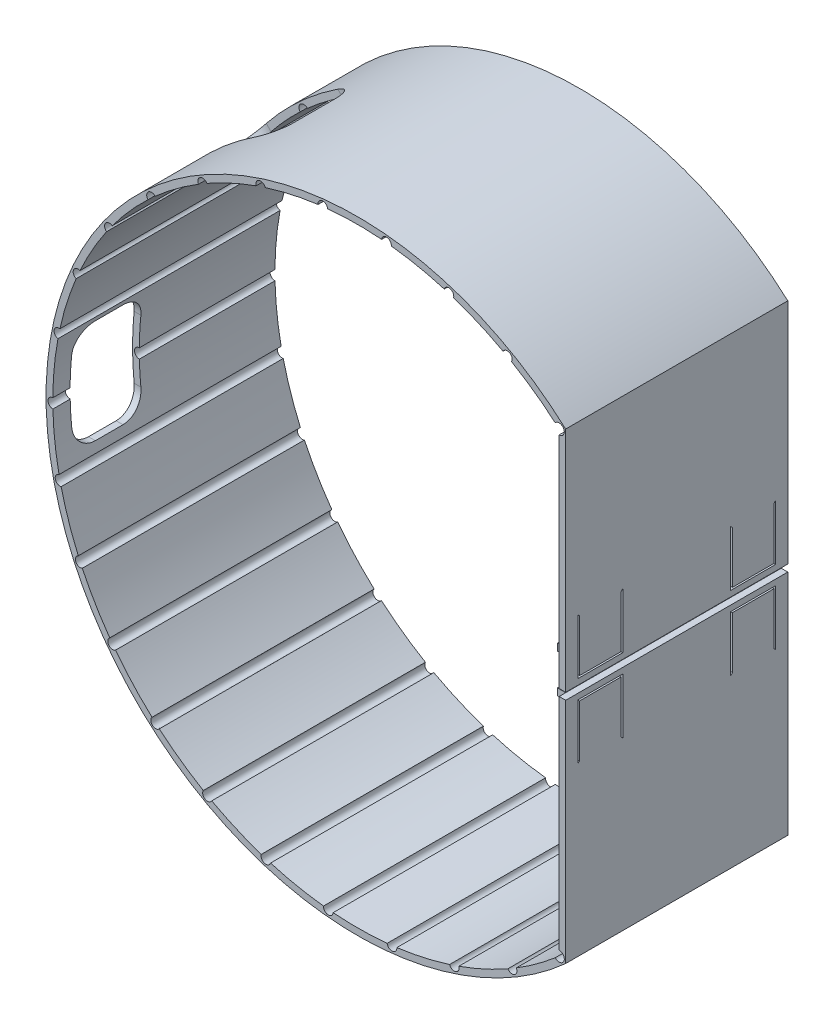
from build123d import *

# Parameters (mm, degrees)
BOSS_EXTRUDE1_DEPTH     = 64.2
SKETCH3_W               = 24
SKETCH3_H               = 40
CUT_EXTRUDE1_DEPTH      = 120.2
SKETCH4_W               = 30
SKETCH4_H               = 20
CUT_EXTRUDE2_DEPTH      = 120.2
FILLET1_R               = 6
SKETCH5_W               = 2
SKETCH5_H               = 9
BOSS_EXTRUDE2_DEPTH     = 6
BOSS_EXTRUDE3_DEPTH     = 9
CUT_EXTRUDE3_DEPTH      = 9
MIRROR2_COPY_1_SKETCH_W = 2
MIRROR2_COPY_1_SKETCH_H = 9
MIRROR2_COPY_1_DEPTH    = 6
MIRROR2_COPY_2_DEPTH    = 9
MIRROR2_COPY_3_DEPTH    = 9
SKETCH9_R               = 1.4
SKETCH9_R_2             = 1.5
CUT_EXTRUDE5_DEPTH      = 100


with BuildPart() as part:
    # Sketch1 → Boss-Extrude1 (new body)
    with BuildSketch(Plane(origin=(0, 0, 0), x_dir=(0, 1, 0), z_dir=(0, 0, 1))):
        with BuildLine():
            Line((-66.902615793, -60.2), (-1, -60.2))
            Line((-1, -60.2), (-1, -58.3))
            Line((-1, -58.3), (-65.984183711, -58.3))
            ThreePointArc((-65.984183711, -58.3), (0, 88.05), (65.984183711, -58.3))
            Line((65.984183711, -58.3), (1, -58.3))
            Line((1, -58.3), (1, -60.2))
            Line((1, -60.2), (66.902615793, -60.2))
            ThreePointArc((66.902615793, -60.2), (0, 90), (-66.902615793, -60.2))
        make_face()
    extrude(amount=BOSS_EXTRUDE1_DEPTH)

    # Sketch3 → Cut-Extrude1 (cut)
    with BuildSketch(Plane(origin=(0, 0, 0), x_dir=(0, 0, -1), z_dir=(0.7071067811865464, -0.7071067811865488, 0))):
        with Locations((-32.2, 3.95)):
            Rectangle(SKETCH3_W, SKETCH3_H)
    extrude(amount=-CUT_EXTRUDE1_DEPTH, mode=Mode.SUBTRACT)

    # Sketch4 → Cut-Extrude2 (cut)
    with BuildSketch(Plane.YZ):
        with Locations((0, 49.2)):
            Rectangle(SKETCH4_W, SKETCH4_H)
    extrude(amount=-CUT_EXTRUDE2_DEPTH, mode=Mode.SUBTRACT)

    # Fillet1
    fillet1_edges = [part.edges().sort_by_distance(p)[0] for p in [
        (-43.693886042, 77.564300861, 44.2),
        (-73.267623998, 50.569496322, 44.2),
        (-73.267623998, 50.569496322, 20.2),
        (-43.693886042, 77.564300861, 20.2),
        (-87.752053224, 15, 39.2),
        (-87.752053224, -15, 39.2),
        (-87.752053224, -15, 59.2),
        (-87.752053224, 15, 59.2),
    ]]
    fillet(fillet1_edges, radius=FILLET1_R)

    # Sketch5 → Boss-Extrude2 (add)
    with BuildSketch(Plane(origin=(58.3, 0, 0), x_dir=(0, -1, 0), z_dir=(-1, 0, 0))):
        with Locations((-5.584183711, 54.2)):
            Rectangle(SKETCH5_W, SKETCH5_H)
    boss_extrude2 = extrude(amount=BOSS_EXTRUDE2_DEPTH)

    # Sketch6 → Boss-Extrude3 (add)
    with BuildSketch(Plane.XY.offset(58.7)):
        Polygon((56.1, 6.584183711), (56.1, 7.584183711), (52.3, 6.584183711), align=None)
    boss_extrude3 = extrude(amount=-BOSS_EXTRUDE3_DEPTH)

    # Sketch7 → Cut-Extrude3 (cut)
    with BuildSketch(Plane(origin=(58.3, 0, 0), x_dir=(0, -1, 0), z_dir=(-1, 0, 0))):
        Polygon((-18.162569822, 60.2), (-3.162569822, 60.2), (-3.162569822, 48.2), (-18.162569822, 48.2), (-18.662569822, 47.7), (-2.662569822, 47.7), (-2.662569822, 60.7), (-18.662569822, 60.7), align=None)
    cut_extrude3 = extrude(amount=-CUT_EXTRUDE3_DEPTH, mode=Mode.SUBTRACT)

    # Mirror1: Boss-Extrude2, Boss-Extrude3, Cut-Extrude3 across plane
    add(boss_extrude2.mirror(Plane.ZX))
    add(boss_extrude3.mirror(Plane.ZX))
    add(cut_extrude3.mirror(Plane.ZX), mode=Mode.SUBTRACT)

    # Mirror2: Boss-Extrude2, Boss-Extrude3, Cut-Extrude3 across plane
    add(boss_extrude2.mirror(Plane.XY.offset(32.1)))
    add(boss_extrude3.mirror(Plane.XY.offset(32.1)))
    add(cut_extrude3.mirror(Plane.XY.offset(32.1)), mode=Mode.SUBTRACT)

    # Mirror2 copy 1 sketch → Mirror2 copy 1 (add)
    with BuildSketch(Plane(origin=(58.3, 0, 64.2), x_dir=(0, 1, 0), z_dir=(-1, 0, 0))):
        with Locations((-5.584183711, 54.2)):
            Rectangle(MIRROR2_COPY_1_SKETCH_W, MIRROR2_COPY_1_SKETCH_H)
    extrude(amount=MIRROR2_COPY_1_DEPTH)

    # Mirror2 copy 2 sketch → Mirror2 copy 2 (add)
    with BuildSketch(Plane(origin=(0, 0, 5.5), x_dir=(1, 0, 0), z_dir=(0, 0, -1))):
        Polygon((56.1, 6.584183711), (56.1, 7.584183711), (52.3, 6.584183711), align=None)
    extrude(amount=-MIRROR2_COPY_2_DEPTH)

    # Mirror2 copy 3 sketch → Mirror2 copy 3 (cut)
    with BuildSketch(Plane(origin=(58.3, 0, 64.2), x_dir=(0, 1, 0), z_dir=(-1, 0, 0))):
        Polygon((-18.162569822, 60.2), (-3.162569822, 60.2), (-3.162569822, 48.2), (-18.162569822, 48.2), (-18.662569822, 47.7), (-2.662569822, 47.7), (-2.662569822, 60.7), (-18.662569822, 60.7), align=None)
    extrude(amount=-MIRROR2_COPY_3_DEPTH, mode=Mode.SUBTRACT)

    # Sketch9 → Cut-Extrude5 (cut)
    with BuildSketch(Plane.XY.offset(64.2)):
        with Locations((-88.046387382, -0.797601996)):
            Circle(SKETCH9_R)
        with Locations((-86.288193351, 17.525700793)):
            Circle(SKETCH9_R)
        with Locations((-80.758791213, 35.083046359)):
            Circle(SKETCH9_R)
        with Locations((-71.699842376, 51.107094452)):
            Circle(SKETCH9_R)
        with Locations((-59.507266373, 64.897517278)):
            Circle(SKETCH9_R)
        with Locations((-44.713937281, 75.851607187)):
            Circle(SKETCH9_R)
        with Locations((-27.96639457, 83.490617885)):
            Circle(SKETCH9_R)
        with Locations((-9.996586218, 87.480687949)):
            Circle(SKETCH9_R)
        with Locations((8.410120921, 87.647432171)):
            Circle(SKETCH9_R)
        with Locations((26.449265419, 83.983563027)):
            Circle(SKETCH9_R)
        with Locations((43.332450101, 76.649209182)):
            Circle(SKETCH9_R)
        with Locations((44.713937281, -75.851607187)):
            Circle(SKETCH9_R)
        with Locations((27.96639457, -83.490617885)):
            Circle(SKETCH9_R)
        with Locations((9.996586218, -87.480687949)):
            Circle(SKETCH9_R)
        with Locations((-8.410120921, -87.647432171)):
            Circle(SKETCH9_R)
        with Locations((-26.449265419, -83.983563027)):
            Circle(SKETCH9_R)
        with Locations((-43.332450101, -76.649209182)):
            Circle(SKETCH9_R)
        with Locations((-58.321798781, -65.964917092)):
            Circle(SKETCH9_R)
        with Locations((-70.762204995, -52.39764159)):
            Circle(SKETCH9_R)
        with Locations((-80.109963297, -36.540337719)):
            Circle(SKETCH9_R)
        with Locations((-85.956531792, -19.086045749)):
            Circle(SKETCH9_R)
        with Locations((58.3, -65.984183711)):
            Circle(SKETCH9_R_2)
        with Locations((58.3, 65.984183711)):
            Circle(SKETCH9_R_2)
    extrude(amount=-CUT_EXTRUDE5_DEPTH, mode=Mode.SUBTRACT)


solid = part.part
